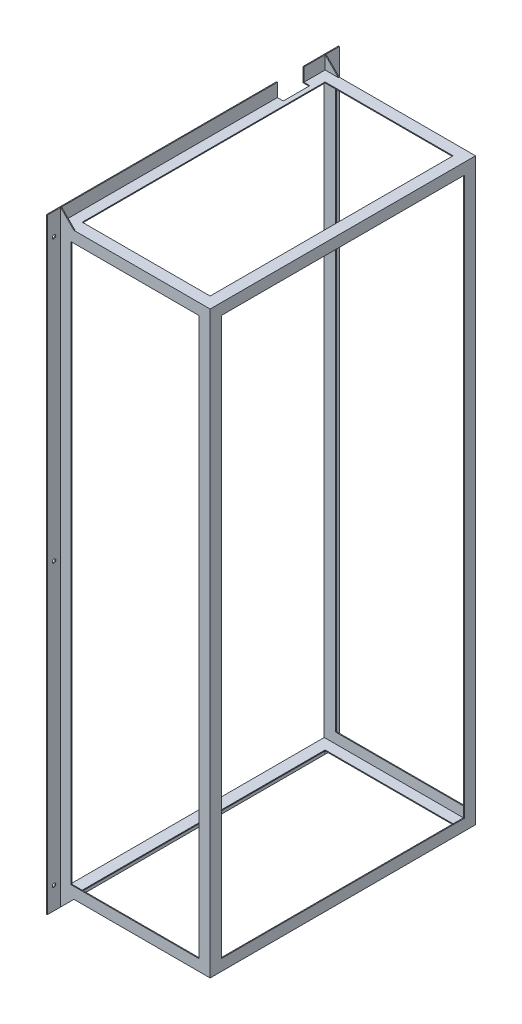
from build123d import *

# Parameters (mm, degrees)
SKETCH1_W            = 600
SKETCH1_H            = 1310
SKETCH1_W_2          = 549.2
SKETCH1_H_2          = 1259.2
BOSS_EXTRUDE1_DEPTH  = 2
SKETCH2_W            = 340
SKETCH2_H            = 1310
SKETCH2_W_2          = 289.2
SKETCH2_H_2          = 1259.2
BOSS_EXTRUDE2_DEPTH  = 2
SKETCH3_W            = 340
SKETCH3_H            = 600
SKETCH3_W_2          = 289.2
SKETCH3_H_2          = 549.2
BOSS_EXTRUDE3_DEPTH  = 2
SKETCH4_W            = 2
SKETCH4_H            = 1310
BOSS_EXTRUDE4_DEPTH  = 30
SKETCH5_W            = 2
SKETCH5_H            = 600
BOSS_EXTRUDE8_DEPTH  = 30
SKETCH8_W            = 2
SKETCH8_H            = 30
BOSS_EXTRUDE9_DEPTH  = 30
BOSS_EXTRUDE10_DEPTH = 2
SKETCH10_W           = 15.4
SKETCH10_H           = 60
CUT_EXTRUDE2_DEPTH   = 55
SKETCH11_R           = 4
CUT_EXTRUDE3_DEPTH   = 10


with BuildPart() as part:
    # Sketch1 → Boss-Extrude1 (new body)
    with BuildSketch(Plane(origin=(0, 0, 0), x_dir=(0, 0, -1), z_dir=(1, 0, 0))):
        Rectangle(SKETCH1_W, SKETCH1_H)
        Rectangle(SKETCH1_W_2, SKETCH1_H_2, mode=Mode.SUBTRACT)
    extrude(amount=BOSS_EXTRUDE1_DEPTH)

    # Sketch2 → Boss-Extrude2 (add)
    with BuildSketch(Plane.XY.offset(300)):
        with Locations((-168, 0)):
            Rectangle(SKETCH2_W, SKETCH2_H)
        with Locations((-168, 0)):
            Rectangle(SKETCH2_W_2, SKETCH2_H_2, mode=Mode.SUBTRACT)
    boss_extrude2 = extrude(amount=-BOSS_EXTRUDE2_DEPTH)

    # Sketch3 → Boss-Extrude3 (add)
    with BuildSketch(Plane(origin=(0, 655, 0), x_dir=(1, 0, 0), z_dir=(0, 1, 0))):
        with Locations((-168, 0)):
            Rectangle(SKETCH3_W, SKETCH3_H)
        with Locations((-168, 0)):
            Rectangle(SKETCH3_W_2, SKETCH3_H_2, mode=Mode.SUBTRACT)
    boss_extrude3 = extrude(amount=-BOSS_EXTRUDE3_DEPTH)

    # Mirror3: Boss-Extrude3 across plane
    add(boss_extrude3.mirror(Plane.ZX))

    # Mirror4: Boss-Extrude2 across plane
    add(boss_extrude2.mirror(Plane.XY))


with BuildPart() as body_2:
    # Sketch4 → Boss-Extrude4 (new body)
    with BuildSketch(Plane.XY.offset(300)):
        with Locations((-337, 0)):
            Rectangle(SKETCH4_W, SKETCH4_H)
    extrude(amount=BOSS_EXTRUDE4_DEPTH)


with BuildPart() as body_3:
    # Sketch5 → Boss-Extrude8 (new body)
    with BuildSketch(Plane(origin=(0, 655, 0), x_dir=(1, 0, 0), z_dir=(0, 1, 0))):
        with Locations((-337, 0)):
            Rectangle(SKETCH5_W, SKETCH5_H)
    extrude(amount=BOSS_EXTRUDE8_DEPTH)


with BuildPart() as body_4:
    # Sketch8 → Boss-Extrude9 (new body)
    with BuildSketch(Plane(origin=(0, 655, 0), x_dir=(1, 0, 0), z_dir=(0, 1, 0))):
        with Locations((-337, -315)):
            Rectangle(SKETCH8_W, SKETCH8_H)
    extrude(amount=BOSS_EXTRUDE9_DEPTH)


with BuildPart() as body_5:
    # Sketch9 → Boss-Extrude10 (new body)
    with BuildSketch(Plane.XY.offset(300)):
        Polygon((-336, 685), (-306, 655), (-336, 655), align=None)
    extrude(amount=-BOSS_EXTRUDE10_DEPTH)


with BuildPart() as body_6:
    # Mirror2: mirrored copy
    add(body_3.part.mirror(Plane.ZX))


with BuildPart() as body_7:
    # Mirror2 2: mirrored copy
    add(body_5.part.mirror(Plane.ZX))


with BuildPart() as body_8:
    # Mirror2 3: mirrored copy
    add(body_4.part.mirror(Plane.ZX))


with BuildPart() as body_9:
    # Mirror5: mirrored copy
    add(body_5.part.mirror(Plane.XY))


with BuildPart() as body_10:
    # Mirror5 2: mirrored copy
    add(body_4.part.mirror(Plane.XY))


with BuildPart() as body_11:
    # Mirror5 3: mirrored copy
    add(body_2.part.mirror(Plane.XY))


with BuildPart() as body_12:
    # Mirror5 4: mirrored copy
    add(body_7.part.mirror(Plane.XY))


with BuildPart() as body_13:
    # Mirror5 5: mirrored copy
    add(body_8.part.mirror(Plane.XY))


with BuildPart() as cut_extrude2_tool:
    # Sketch10 → Cut-Extrude2 (new body)
    with BuildSketch(Plane(origin=(0, 685, 0), x_dir=(1, 0, 0), z_dir=(0, 1, 0))):
        with Locations((-330.3, 220)):
            Rectangle(SKETCH10_W, SKETCH10_H)
    extrude(amount=-CUT_EXTRUDE2_DEPTH)


with BuildPart() as part_1:
    add(part.part)

    # Cut-Extrude2: cut by cut_extrude2_tool
    add(cut_extrude2_tool.part, mode=Mode.SUBTRACT)


with BuildPart() as body_3_1:
    add(body_3.part)

    # Cut-Extrude2: cut by cut_extrude2_tool
    add(cut_extrude2_tool.part, mode=Mode.SUBTRACT)


with BuildPart() as cut_extrude3_tool:
    # Sketch11 → Cut-Extrude3 (new body)
    with BuildSketch(Plane(origin=(-336, 0, 0), x_dir=(0, 0, -1), z_dir=(1, 0, 0))):
        with Locations(Location((315, 635, 0), (0, 0, 90))):
            Circle(SKETCH11_R)
        with Locations(Location((315, 0, 0), (0, 0, 90))):
            Circle(SKETCH11_R)
        with Locations(Location((315, -635, 0), (0, 0, 90))):
            Circle(SKETCH11_R)
        with Locations(Location((-315, -635, 0), (0, 0, 90))):
            Circle(SKETCH11_R)
        with Locations(Location((-315, 0, 0), (0, 0, 90))):
            Circle(SKETCH11_R)
        with Locations(Location((-315, 635, 0), (0, 0, 90))):
            Circle(SKETCH11_R)
    extrude(amount=-CUT_EXTRUDE3_DEPTH)


with BuildPart() as body_2_1:
    add(body_2.part)

    # Cut-Extrude3: cut by cut_extrude3_tool
    add(cut_extrude3_tool.part, mode=Mode.SUBTRACT)


with BuildPart() as body_11_1:
    add(body_11.part)

    # Cut-Extrude3: cut by cut_extrude3_tool
    add(cut_extrude3_tool.part, mode=Mode.SUBTRACT)


with BuildPart() as part_2:
    add(part_1.part)

    # Combine1: read off the stored shape, not the designer's step
    # Combine1: union body 3, body 12, body 10, body 13, body 6, body 8, body 4, body 2, body 11, body 9, body 7, body 5
    add(body_3_1.part)
    add(body_12.part)
    add(body_10.part)
    add(body_13.part)
    add(body_6.part)
    add(body_8.part)
    add(body_4.part)
    add(body_2_1.part)
    add(body_11_1.part)
    add(body_9.part)
    add(body_7.part)
    add(body_5.part)


solid = part_2.part
